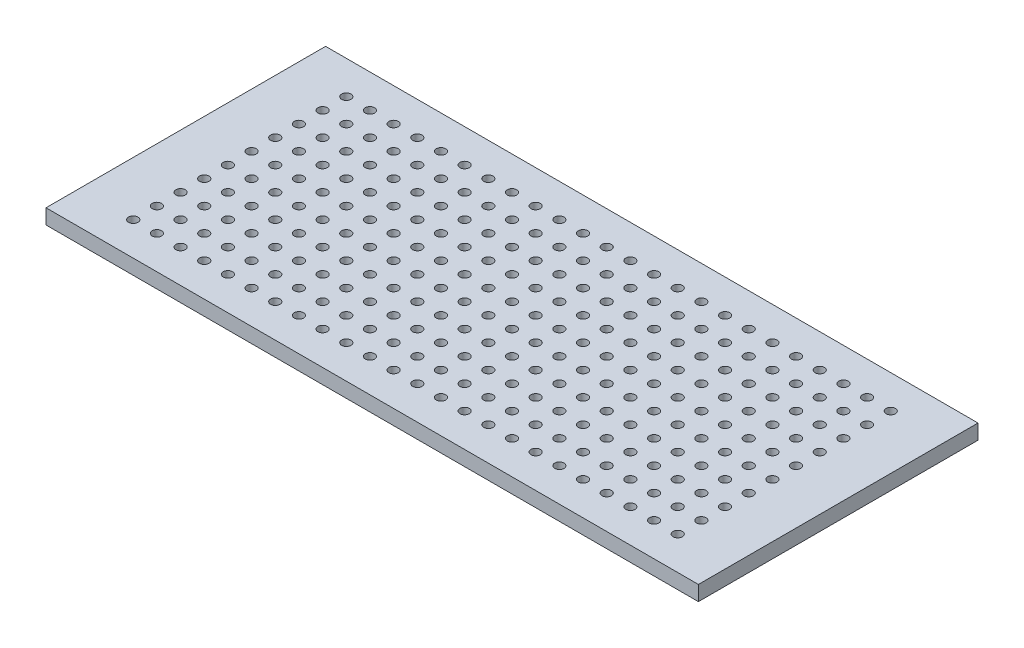
from build123d import *

# Parameters (mm, degrees)
SKETCH1_W                        = 70
SKETCH1_H                        = 30
BOSS_EXTRUDE1_DEPTH              = 1.6
F_1_0_1_DIAMETER_HOLE1_OUTLINE_R = 0.5
F_1_0_1_DIAMETER_HOLE1_DEPTH     = 1.6


# Read off the part's stored shape, not the designer's step: Ø1.0 (1) Diameter Hole1
with BuildPart() as part:
    # Sketch1 → Boss-Extrude1 (new body)
    with BuildSketch(Plane(origin=(0, 0, 0), x_dir=(1, 0, 0), z_dir=(0, 1, 0))):
        Rectangle(SKETCH1_W, SKETCH1_H)
    extrude(amount=BOSS_EXTRUDE1_DEPTH)

    # Ø1.0 (1) Diameter Hole1 outline → Ø1.0 (1) Diameter Hole1 (cut)
    with BuildSketch(Plane(origin=(0, 0, 0), x_dir=(1, 0, 0), z_dir=(0, 1, 0))):
        with Locations((1.27, 1.27)):
            Circle(F_1_0_1_DIAMETER_HOLE1_OUTLINE_R)
        with Locations((-1.27, 1.27)):
            Circle(F_1_0_1_DIAMETER_HOLE1_OUTLINE_R)
        with Locations((-3.81, 1.27)):
            Circle(F_1_0_1_DIAMETER_HOLE1_OUTLINE_R)
        with Locations((-6.35, 1.27)):
            Circle(F_1_0_1_DIAMETER_HOLE1_OUTLINE_R)
        with Locations((-16.51, -3.81)):
            Circle(F_1_0_1_DIAMETER_HOLE1_OUTLINE_R)
        with Locations((-6.35, 3.81)):
            Circle(F_1_0_1_DIAMETER_HOLE1_OUTLINE_R)
        with Locations((-3.81, 6.35)):
            Circle(F_1_0_1_DIAMETER_HOLE1_OUTLINE_R)
        with Locations((-3.81, 3.81)):
            Circle(F_1_0_1_DIAMETER_HOLE1_OUTLINE_R)
        with Locations((-1.27, 3.81)):
            Circle(F_1_0_1_DIAMETER_HOLE1_OUTLINE_R)
        with Locations((1.27, 3.81)):
            Circle(F_1_0_1_DIAMETER_HOLE1_OUTLINE_R)
        with Locations((1.27, 6.35)):
            Circle(F_1_0_1_DIAMETER_HOLE1_OUTLINE_R)
        with Locations((-1.27, 6.35)):
            Circle(F_1_0_1_DIAMETER_HOLE1_OUTLINE_R)
        with Locations((-6.35, 6.35)):
            Circle(F_1_0_1_DIAMETER_HOLE1_OUTLINE_R)
        with Locations((-6.35, 8.89)):
            Circle(F_1_0_1_DIAMETER_HOLE1_OUTLINE_R)
        with Locations((-3.81, 8.89)):
            Circle(F_1_0_1_DIAMETER_HOLE1_OUTLINE_R)
        with Locations((-1.27, 8.89)):
            Circle(F_1_0_1_DIAMETER_HOLE1_OUTLINE_R)
        with Locations((1.27, 8.89)):
            Circle(F_1_0_1_DIAMETER_HOLE1_OUTLINE_R)
        with Locations((1.27, 11.43)):
            Circle(F_1_0_1_DIAMETER_HOLE1_OUTLINE_R)
        with Locations((-1.27, 11.43)):
            Circle(F_1_0_1_DIAMETER_HOLE1_OUTLINE_R)
        with Locations((-3.81, 11.43)):
            Circle(F_1_0_1_DIAMETER_HOLE1_OUTLINE_R)
        with Locations((-6.35, 11.43)):
            Circle(F_1_0_1_DIAMETER_HOLE1_OUTLINE_R)
        with Locations((-8.89, 11.43)):
            Circle(F_1_0_1_DIAMETER_HOLE1_OUTLINE_R)
        with Locations((-8.89, 8.89)):
            Circle(F_1_0_1_DIAMETER_HOLE1_OUTLINE_R)
        with Locations((-8.89, 6.35)):
            Circle(F_1_0_1_DIAMETER_HOLE1_OUTLINE_R)
        with Locations((-8.89, 3.81)):
            Circle(F_1_0_1_DIAMETER_HOLE1_OUTLINE_R)
        with Locations((-8.89, 1.27)):
            Circle(F_1_0_1_DIAMETER_HOLE1_OUTLINE_R)
        with Locations((-11.43, 1.27)):
            Circle(F_1_0_1_DIAMETER_HOLE1_OUTLINE_R)
        with Locations((-11.43, 3.81)):
            Circle(F_1_0_1_DIAMETER_HOLE1_OUTLINE_R)
        with Locations((-11.43, 6.35)):
            Circle(F_1_0_1_DIAMETER_HOLE1_OUTLINE_R)
        with Locations((-11.43, 8.89)):
            Circle(F_1_0_1_DIAMETER_HOLE1_OUTLINE_R)
        with Locations((-11.43, 11.43)):
            Circle(F_1_0_1_DIAMETER_HOLE1_OUTLINE_R)
        with Locations((-13.97, 11.43)):
            Circle(F_1_0_1_DIAMETER_HOLE1_OUTLINE_R)
        with Locations((-13.97, 8.89)):
            Circle(F_1_0_1_DIAMETER_HOLE1_OUTLINE_R)
        with Locations((-13.97, 6.35)):
            Circle(F_1_0_1_DIAMETER_HOLE1_OUTLINE_R)
        with Locations((-13.97, 3.81)):
            Circle(F_1_0_1_DIAMETER_HOLE1_OUTLINE_R)
        with Locations((-13.97, 1.27)):
            Circle(F_1_0_1_DIAMETER_HOLE1_OUTLINE_R)
        with Locations((-16.51, 1.27)):
            Circle(F_1_0_1_DIAMETER_HOLE1_OUTLINE_R)
        with Locations((-19.05, 3.81)):
            Circle(F_1_0_1_DIAMETER_HOLE1_OUTLINE_R)
        with Locations((-16.51, 3.81)):
            Circle(F_1_0_1_DIAMETER_HOLE1_OUTLINE_R)
        with Locations((-16.51, 6.35)):
            Circle(F_1_0_1_DIAMETER_HOLE1_OUTLINE_R)
        with Locations((-16.51, 8.89)):
            Circle(F_1_0_1_DIAMETER_HOLE1_OUTLINE_R)
        with Locations((-19.05, 11.43)):
            Circle(F_1_0_1_DIAMETER_HOLE1_OUTLINE_R)
        with Locations((-16.51, 11.43)):
            Circle(F_1_0_1_DIAMETER_HOLE1_OUTLINE_R)
        with Locations((-19.05, 8.89)):
            Circle(F_1_0_1_DIAMETER_HOLE1_OUTLINE_R)
        with Locations((-19.05, 6.35)):
            Circle(F_1_0_1_DIAMETER_HOLE1_OUTLINE_R)
        with Locations((-19.05, 1.27)):
            Circle(F_1_0_1_DIAMETER_HOLE1_OUTLINE_R)
        with Locations((-19.05, -3.81)):
            Circle(F_1_0_1_DIAMETER_HOLE1_OUTLINE_R)
        with Locations((-19.05, -1.27)):
            Circle(F_1_0_1_DIAMETER_HOLE1_OUTLINE_R)
        with Locations((-16.51, -1.27)):
            Circle(F_1_0_1_DIAMETER_HOLE1_OUTLINE_R)
        with Locations((-13.97, -3.81)):
            Circle(F_1_0_1_DIAMETER_HOLE1_OUTLINE_R)
        with Locations((-13.97, -1.27)):
            Circle(F_1_0_1_DIAMETER_HOLE1_OUTLINE_R)
        with Locations((-11.43, -1.27)):
            Circle(F_1_0_1_DIAMETER_HOLE1_OUTLINE_R)
        with Locations((-11.43, -3.81)):
            Circle(F_1_0_1_DIAMETER_HOLE1_OUTLINE_R)
        with Locations((-8.89, -3.81)):
            Circle(F_1_0_1_DIAMETER_HOLE1_OUTLINE_R)
        with Locations((-8.89, -1.27)):
            Circle(F_1_0_1_DIAMETER_HOLE1_OUTLINE_R)
        with Locations((-6.35, -1.27)):
            Circle(F_1_0_1_DIAMETER_HOLE1_OUTLINE_R)
        with Locations((-6.35, -3.81)):
            Circle(F_1_0_1_DIAMETER_HOLE1_OUTLINE_R)
        with Locations((-3.81, -3.81)):
            Circle(F_1_0_1_DIAMETER_HOLE1_OUTLINE_R)
        with Locations((-3.81, -1.27)):
            Circle(F_1_0_1_DIAMETER_HOLE1_OUTLINE_R)
        with Locations((-1.27, -3.81)):
            Circle(F_1_0_1_DIAMETER_HOLE1_OUTLINE_R)
        with Locations((-1.27, -1.27)):
            Circle(F_1_0_1_DIAMETER_HOLE1_OUTLINE_R)
        with Locations((1.27, -1.27)):
            Circle(F_1_0_1_DIAMETER_HOLE1_OUTLINE_R)
        with Locations((1.27, -3.81)):
            Circle(F_1_0_1_DIAMETER_HOLE1_OUTLINE_R)
        with Locations((3.81, -3.81)):
            Circle(F_1_0_1_DIAMETER_HOLE1_OUTLINE_R)
        with Locations((6.35, -3.81)):
            Circle(F_1_0_1_DIAMETER_HOLE1_OUTLINE_R)
        with Locations((6.35, -1.27)):
            Circle(F_1_0_1_DIAMETER_HOLE1_OUTLINE_R)
        with Locations((3.81, -1.27)):
            Circle(F_1_0_1_DIAMETER_HOLE1_OUTLINE_R)
        with Locations((3.81, 1.27)):
            Circle(F_1_0_1_DIAMETER_HOLE1_OUTLINE_R)
        with Locations((6.35, 1.27)):
            Circle(F_1_0_1_DIAMETER_HOLE1_OUTLINE_R)
        with Locations((6.35, 3.81)):
            Circle(F_1_0_1_DIAMETER_HOLE1_OUTLINE_R)
        with Locations((3.81, 3.81)):
            Circle(F_1_0_1_DIAMETER_HOLE1_OUTLINE_R)
        with Locations((3.81, 6.35)):
            Circle(F_1_0_1_DIAMETER_HOLE1_OUTLINE_R)
        with Locations((6.35, 6.35)):
            Circle(F_1_0_1_DIAMETER_HOLE1_OUTLINE_R)
        with Locations((6.35, 8.89)):
            Circle(F_1_0_1_DIAMETER_HOLE1_OUTLINE_R)
        with Locations((3.81, 8.89)):
            Circle(F_1_0_1_DIAMETER_HOLE1_OUTLINE_R)
        with Locations((3.81, 11.43)):
            Circle(F_1_0_1_DIAMETER_HOLE1_OUTLINE_R)
        with Locations((6.35, 11.43)):
            Circle(F_1_0_1_DIAMETER_HOLE1_OUTLINE_R)
        with Locations((8.89, -1.27)):
            Circle(F_1_0_1_DIAMETER_HOLE1_OUTLINE_R)
        with Locations((8.89, -3.81)):
            Circle(F_1_0_1_DIAMETER_HOLE1_OUTLINE_R)
        with Locations((11.43, -3.81)):
            Circle(F_1_0_1_DIAMETER_HOLE1_OUTLINE_R)
        with Locations((11.43, -1.27)):
            Circle(F_1_0_1_DIAMETER_HOLE1_OUTLINE_R)
        with Locations((11.43, 1.27)):
            Circle(F_1_0_1_DIAMETER_HOLE1_OUTLINE_R)
        with Locations((8.89, 1.27)):
            Circle(F_1_0_1_DIAMETER_HOLE1_OUTLINE_R)
        with Locations((8.89, 3.81)):
            Circle(F_1_0_1_DIAMETER_HOLE1_OUTLINE_R)
        with Locations((11.43, 3.81)):
            Circle(F_1_0_1_DIAMETER_HOLE1_OUTLINE_R)
        with Locations((11.43, 6.35)):
            Circle(F_1_0_1_DIAMETER_HOLE1_OUTLINE_R)
        with Locations((8.89, 6.35)):
            Circle(F_1_0_1_DIAMETER_HOLE1_OUTLINE_R)
        with Locations((8.89, 8.89)):
            Circle(F_1_0_1_DIAMETER_HOLE1_OUTLINE_R)
        with Locations((8.89, 11.43)):
            Circle(F_1_0_1_DIAMETER_HOLE1_OUTLINE_R)
        with Locations((11.43, 8.89)):
            Circle(F_1_0_1_DIAMETER_HOLE1_OUTLINE_R)
        with Locations((11.43, 11.43)):
            Circle(F_1_0_1_DIAMETER_HOLE1_OUTLINE_R)
        with Locations((13.97, 11.43)):
            Circle(F_1_0_1_DIAMETER_HOLE1_OUTLINE_R)
        with Locations((16.51, -1.27)):
            Circle(F_1_0_1_DIAMETER_HOLE1_OUTLINE_R)
        with Locations((16.51, 1.27)):
            Circle(F_1_0_1_DIAMETER_HOLE1_OUTLINE_R)
        with Locations((16.51, 3.81)):
            Circle(F_1_0_1_DIAMETER_HOLE1_OUTLINE_R)
        with Locations((16.51, 6.35)):
            Circle(F_1_0_1_DIAMETER_HOLE1_OUTLINE_R)
        with Locations((16.51, 8.89)):
            Circle(F_1_0_1_DIAMETER_HOLE1_OUTLINE_R)
        with Locations((16.51, 11.43)):
            Circle(F_1_0_1_DIAMETER_HOLE1_OUTLINE_R)
        with Locations((13.97, 8.89)):
            Circle(F_1_0_1_DIAMETER_HOLE1_OUTLINE_R)
        with Locations((13.97, 6.35)):
            Circle(F_1_0_1_DIAMETER_HOLE1_OUTLINE_R)
        with Locations((13.97, 3.81)):
            Circle(F_1_0_1_DIAMETER_HOLE1_OUTLINE_R)
        with Locations((13.97, 1.27)):
            Circle(F_1_0_1_DIAMETER_HOLE1_OUTLINE_R)
        with Locations((13.97, -1.27)):
            Circle(F_1_0_1_DIAMETER_HOLE1_OUTLINE_R)
        with Locations((13.97, -3.81)):
            Circle(F_1_0_1_DIAMETER_HOLE1_OUTLINE_R)
        with Locations((16.51, -3.81)):
            Circle(F_1_0_1_DIAMETER_HOLE1_OUTLINE_R)
        with Locations((19.05, -3.81)):
            Circle(F_1_0_1_DIAMETER_HOLE1_OUTLINE_R)
        with Locations((21.59, -3.81)):
            Circle(F_1_0_1_DIAMETER_HOLE1_OUTLINE_R)
        with Locations((21.59, -1.27)):
            Circle(F_1_0_1_DIAMETER_HOLE1_OUTLINE_R)
        with Locations((19.05, -1.27)):
            Circle(F_1_0_1_DIAMETER_HOLE1_OUTLINE_R)
        with Locations((19.05, 1.27)):
            Circle(F_1_0_1_DIAMETER_HOLE1_OUTLINE_R)
        with Locations((19.05, 3.81)):
            Circle(F_1_0_1_DIAMETER_HOLE1_OUTLINE_R)
        with Locations((19.05, 6.35)):
            Circle(F_1_0_1_DIAMETER_HOLE1_OUTLINE_R)
        with Locations((19.05, 8.89)):
            Circle(F_1_0_1_DIAMETER_HOLE1_OUTLINE_R)
        with Locations((19.05, 11.43)):
            Circle(F_1_0_1_DIAMETER_HOLE1_OUTLINE_R)
        with Locations((21.59, 11.43)):
            Circle(F_1_0_1_DIAMETER_HOLE1_OUTLINE_R)
        with Locations((21.59, 8.89)):
            Circle(F_1_0_1_DIAMETER_HOLE1_OUTLINE_R)
        with Locations((21.59, 6.35)):
            Circle(F_1_0_1_DIAMETER_HOLE1_OUTLINE_R)
        with Locations((21.59, 3.81)):
            Circle(F_1_0_1_DIAMETER_HOLE1_OUTLINE_R)
        with Locations((21.59, 1.27)):
            Circle(F_1_0_1_DIAMETER_HOLE1_OUTLINE_R)
        with Locations((26.67, 1.27)):
            Circle(F_1_0_1_DIAMETER_HOLE1_OUTLINE_R)
        with Locations((26.67, 3.81)):
            Circle(F_1_0_1_DIAMETER_HOLE1_OUTLINE_R)
        with Locations((26.67, 6.35)):
            Circle(F_1_0_1_DIAMETER_HOLE1_OUTLINE_R)
        with Locations((26.67, 8.89)):
            Circle(F_1_0_1_DIAMETER_HOLE1_OUTLINE_R)
        with Locations((26.67, 11.43)):
            Circle(F_1_0_1_DIAMETER_HOLE1_OUTLINE_R)
        with Locations((24.13, 11.43)):
            Circle(F_1_0_1_DIAMETER_HOLE1_OUTLINE_R)
        with Locations((24.13, 8.89)):
            Circle(F_1_0_1_DIAMETER_HOLE1_OUTLINE_R)
        with Locations((24.13, 6.35)):
            Circle(F_1_0_1_DIAMETER_HOLE1_OUTLINE_R)
        with Locations((24.13, 3.81)):
            Circle(F_1_0_1_DIAMETER_HOLE1_OUTLINE_R)
        with Locations((24.13, 1.27)):
            Circle(F_1_0_1_DIAMETER_HOLE1_OUTLINE_R)
        with Locations((24.13, -3.81)):
            Circle(F_1_0_1_DIAMETER_HOLE1_OUTLINE_R)
        with Locations((24.13, -1.27)):
            Circle(F_1_0_1_DIAMETER_HOLE1_OUTLINE_R)
        with Locations((26.67, -1.27)):
            Circle(F_1_0_1_DIAMETER_HOLE1_OUTLINE_R)
        with Locations((26.67, -3.81)):
            Circle(F_1_0_1_DIAMETER_HOLE1_OUTLINE_R)
        with Locations((26.67, -8.89)):
            Circle(F_1_0_1_DIAMETER_HOLE1_OUTLINE_R)
        with Locations((24.13, -8.89)):
            Circle(F_1_0_1_DIAMETER_HOLE1_OUTLINE_R)
        with Locations((21.59, -8.89)):
            Circle(F_1_0_1_DIAMETER_HOLE1_OUTLINE_R)
        with Locations((19.05, -8.89)):
            Circle(F_1_0_1_DIAMETER_HOLE1_OUTLINE_R)
        with Locations((16.51, -8.89)):
            Circle(F_1_0_1_DIAMETER_HOLE1_OUTLINE_R)
        with Locations((13.97, -8.89)):
            Circle(F_1_0_1_DIAMETER_HOLE1_OUTLINE_R)
        with Locations((11.43, -8.89)):
            Circle(F_1_0_1_DIAMETER_HOLE1_OUTLINE_R)
        with Locations((8.89, -8.89)):
            Circle(F_1_0_1_DIAMETER_HOLE1_OUTLINE_R)
        with Locations((6.35, -8.89)):
            Circle(F_1_0_1_DIAMETER_HOLE1_OUTLINE_R)
        with Locations((3.81, -8.89)):
            Circle(F_1_0_1_DIAMETER_HOLE1_OUTLINE_R)
        with Locations((1.27, -8.89)):
            Circle(F_1_0_1_DIAMETER_HOLE1_OUTLINE_R)
        with Locations((-1.27, -8.89)):
            Circle(F_1_0_1_DIAMETER_HOLE1_OUTLINE_R)
        with Locations((-3.81, -8.89)):
            Circle(F_1_0_1_DIAMETER_HOLE1_OUTLINE_R)
        with Locations((-6.35, -8.89)):
            Circle(F_1_0_1_DIAMETER_HOLE1_OUTLINE_R)
        with Locations((-8.89, -8.89)):
            Circle(F_1_0_1_DIAMETER_HOLE1_OUTLINE_R)
        with Locations((-11.43, -8.89)):
            Circle(F_1_0_1_DIAMETER_HOLE1_OUTLINE_R)
        with Locations((-16.51, -11.43)):
            Circle(F_1_0_1_DIAMETER_HOLE1_OUTLINE_R)
        with Locations((-19.05, -11.43)):
            Circle(F_1_0_1_DIAMETER_HOLE1_OUTLINE_R)
        with Locations((-19.05, -8.89)):
            Circle(F_1_0_1_DIAMETER_HOLE1_OUTLINE_R)
        with Locations((-16.51, -8.89)):
            Circle(F_1_0_1_DIAMETER_HOLE1_OUTLINE_R)
        with Locations((-13.97, -8.89)):
            Circle(F_1_0_1_DIAMETER_HOLE1_OUTLINE_R)
        with Locations((-13.97, -11.43)):
            Circle(F_1_0_1_DIAMETER_HOLE1_OUTLINE_R)
        with Locations((-11.43, -11.43)):
            Circle(F_1_0_1_DIAMETER_HOLE1_OUTLINE_R)
        with Locations((-8.89, -11.43)):
            Circle(F_1_0_1_DIAMETER_HOLE1_OUTLINE_R)
        with Locations((-6.35, -11.43)):
            Circle(F_1_0_1_DIAMETER_HOLE1_OUTLINE_R)
        with Locations((-3.81, -11.43)):
            Circle(F_1_0_1_DIAMETER_HOLE1_OUTLINE_R)
        with Locations((-1.27, -11.43)):
            Circle(F_1_0_1_DIAMETER_HOLE1_OUTLINE_R)
        with Locations((1.27, -11.43)):
            Circle(F_1_0_1_DIAMETER_HOLE1_OUTLINE_R)
        with Locations((3.81, -11.43)):
            Circle(F_1_0_1_DIAMETER_HOLE1_OUTLINE_R)
        with Locations((6.35, -11.43)):
            Circle(F_1_0_1_DIAMETER_HOLE1_OUTLINE_R)
        with Locations((8.89, -11.43)):
            Circle(F_1_0_1_DIAMETER_HOLE1_OUTLINE_R)
        with Locations((11.43, -11.43)):
            Circle(F_1_0_1_DIAMETER_HOLE1_OUTLINE_R)
        with Locations((13.97, -11.43)):
            Circle(F_1_0_1_DIAMETER_HOLE1_OUTLINE_R)
        with Locations((16.51, -11.43)):
            Circle(F_1_0_1_DIAMETER_HOLE1_OUTLINE_R)
        with Locations((19.05, -11.43)):
            Circle(F_1_0_1_DIAMETER_HOLE1_OUTLINE_R)
        with Locations((21.59, -11.43)):
            Circle(F_1_0_1_DIAMETER_HOLE1_OUTLINE_R)
        with Locations((24.13, -11.43)):
            Circle(F_1_0_1_DIAMETER_HOLE1_OUTLINE_R)
        with Locations((26.67, -11.43)):
            Circle(F_1_0_1_DIAMETER_HOLE1_OUTLINE_R)
        with Locations((29.21, -11.43)):
            Circle(F_1_0_1_DIAMETER_HOLE1_OUTLINE_R)
        with Locations((29.21, -8.89)):
            Circle(F_1_0_1_DIAMETER_HOLE1_OUTLINE_R)
        with Locations((29.21, 11.43)):
            Circle(F_1_0_1_DIAMETER_HOLE1_OUTLINE_R)
        with Locations((29.21, 8.89)):
            Circle(F_1_0_1_DIAMETER_HOLE1_OUTLINE_R)
        with Locations((29.21, 6.35)):
            Circle(F_1_0_1_DIAMETER_HOLE1_OUTLINE_R)
        with Locations((29.21, 3.81)):
            Circle(F_1_0_1_DIAMETER_HOLE1_OUTLINE_R)
        with Locations((29.21, 1.27)):
            Circle(F_1_0_1_DIAMETER_HOLE1_OUTLINE_R)
        with Locations((29.21, -1.27)):
            Circle(F_1_0_1_DIAMETER_HOLE1_OUTLINE_R)
        with Locations((29.21, -3.81)):
            Circle(F_1_0_1_DIAMETER_HOLE1_OUTLINE_R)
        with Locations((29.21, -6.35)):
            Circle(F_1_0_1_DIAMETER_HOLE1_OUTLINE_R)
        with Locations((26.67, -6.35)):
            Circle(F_1_0_1_DIAMETER_HOLE1_OUTLINE_R)
        with Locations((24.13, -6.35)):
            Circle(F_1_0_1_DIAMETER_HOLE1_OUTLINE_R)
        with Locations((21.59, -6.35)):
            Circle(F_1_0_1_DIAMETER_HOLE1_OUTLINE_R)
        with Locations((19.05, -6.35)):
            Circle(F_1_0_1_DIAMETER_HOLE1_OUTLINE_R)
        with Locations((16.51, -6.35)):
            Circle(F_1_0_1_DIAMETER_HOLE1_OUTLINE_R)
        with Locations((13.97, -6.35)):
            Circle(F_1_0_1_DIAMETER_HOLE1_OUTLINE_R)
        with Locations((11.43, -6.35)):
            Circle(F_1_0_1_DIAMETER_HOLE1_OUTLINE_R)
        with Locations((8.89, -6.35)):
            Circle(F_1_0_1_DIAMETER_HOLE1_OUTLINE_R)
        with Locations((6.35, -6.35)):
            Circle(F_1_0_1_DIAMETER_HOLE1_OUTLINE_R)
        with Locations((3.81, -6.35)):
            Circle(F_1_0_1_DIAMETER_HOLE1_OUTLINE_R)
        with Locations((1.27, -6.35)):
            Circle(F_1_0_1_DIAMETER_HOLE1_OUTLINE_R)
        with Locations((-1.27, -6.35)):
            Circle(F_1_0_1_DIAMETER_HOLE1_OUTLINE_R)
        with Locations((-3.81, -6.35)):
            Circle(F_1_0_1_DIAMETER_HOLE1_OUTLINE_R)
        with Locations((-6.35, -6.35)):
            Circle(F_1_0_1_DIAMETER_HOLE1_OUTLINE_R)
        with Locations((-8.89, -6.35)):
            Circle(F_1_0_1_DIAMETER_HOLE1_OUTLINE_R)
        with Locations((-11.43, -6.35)):
            Circle(F_1_0_1_DIAMETER_HOLE1_OUTLINE_R)
        with Locations((-13.97, -6.35)):
            Circle(F_1_0_1_DIAMETER_HOLE1_OUTLINE_R)
        with Locations((-16.51, -6.35)):
            Circle(F_1_0_1_DIAMETER_HOLE1_OUTLINE_R)
        with Locations((-19.05, -6.35)):
            Circle(F_1_0_1_DIAMETER_HOLE1_OUTLINE_R)
        with Locations((-21.59, -6.35)):
            Circle(F_1_0_1_DIAMETER_HOLE1_OUTLINE_R)
        with Locations((-21.59, -3.81)):
            Circle(F_1_0_1_DIAMETER_HOLE1_OUTLINE_R)
        with Locations((-21.59, -1.27)):
            Circle(F_1_0_1_DIAMETER_HOLE1_OUTLINE_R)
        with Locations((-21.59, 1.27)):
            Circle(F_1_0_1_DIAMETER_HOLE1_OUTLINE_R)
        with Locations((-21.59, 3.81)):
            Circle(F_1_0_1_DIAMETER_HOLE1_OUTLINE_R)
        with Locations((-21.59, 6.35)):
            Circle(F_1_0_1_DIAMETER_HOLE1_OUTLINE_R)
        with Locations((-21.59, 8.89)):
            Circle(F_1_0_1_DIAMETER_HOLE1_OUTLINE_R)
        with Locations((-21.59, 11.43)):
            Circle(F_1_0_1_DIAMETER_HOLE1_OUTLINE_R)
        with Locations((-24.13, 11.43)):
            Circle(F_1_0_1_DIAMETER_HOLE1_OUTLINE_R)
        with Locations((-24.13, 8.89)):
            Circle(F_1_0_1_DIAMETER_HOLE1_OUTLINE_R)
        with Locations((-24.13, 6.35)):
            Circle(F_1_0_1_DIAMETER_HOLE1_OUTLINE_R)
        with Locations((-24.13, 3.81)):
            Circle(F_1_0_1_DIAMETER_HOLE1_OUTLINE_R)
        with Locations((-24.13, 1.27)):
            Circle(F_1_0_1_DIAMETER_HOLE1_OUTLINE_R)
        with Locations((-24.13, -1.27)):
            Circle(F_1_0_1_DIAMETER_HOLE1_OUTLINE_R)
        with Locations((-24.13, -3.81)):
            Circle(F_1_0_1_DIAMETER_HOLE1_OUTLINE_R)
        with Locations((-24.13, -6.35)):
            Circle(F_1_0_1_DIAMETER_HOLE1_OUTLINE_R)
        with Locations((-24.13, -8.89)):
            Circle(F_1_0_1_DIAMETER_HOLE1_OUTLINE_R)
        with Locations((-21.59, -8.89)):
            Circle(F_1_0_1_DIAMETER_HOLE1_OUTLINE_R)
        with Locations((-21.59, -11.43)):
            Circle(F_1_0_1_DIAMETER_HOLE1_OUTLINE_R)
        with Locations((-24.13, -11.43)):
            Circle(F_1_0_1_DIAMETER_HOLE1_OUTLINE_R)
        with Locations((-29.21, -11.43)):
            Circle(F_1_0_1_DIAMETER_HOLE1_OUTLINE_R)
        with Locations((-26.67, -11.43)):
            Circle(F_1_0_1_DIAMETER_HOLE1_OUTLINE_R)
        with Locations((-26.67, -8.89)):
            Circle(F_1_0_1_DIAMETER_HOLE1_OUTLINE_R)
        with Locations((-29.21, -8.89)):
            Circle(F_1_0_1_DIAMETER_HOLE1_OUTLINE_R)
        with Locations((-29.21, -6.35)):
            Circle(F_1_0_1_DIAMETER_HOLE1_OUTLINE_R)
        with Locations((-26.67, -6.35)):
            Circle(F_1_0_1_DIAMETER_HOLE1_OUTLINE_R)
        with Locations((-26.67, -3.81)):
            Circle(F_1_0_1_DIAMETER_HOLE1_OUTLINE_R)
        with Locations((-29.21, -3.81)):
            Circle(F_1_0_1_DIAMETER_HOLE1_OUTLINE_R)
        with Locations((-29.21, -1.27)):
            Circle(F_1_0_1_DIAMETER_HOLE1_OUTLINE_R)
        with Locations((-26.67, -1.27)):
            Circle(F_1_0_1_DIAMETER_HOLE1_OUTLINE_R)
        with Locations((-26.67, 1.27)):
            Circle(F_1_0_1_DIAMETER_HOLE1_OUTLINE_R)
        with Locations((-29.21, 1.27)):
            Circle(F_1_0_1_DIAMETER_HOLE1_OUTLINE_R)
        with Locations((-29.21, 3.81)):
            Circle(F_1_0_1_DIAMETER_HOLE1_OUTLINE_R)
        with Locations((-26.67, 3.81)):
            Circle(F_1_0_1_DIAMETER_HOLE1_OUTLINE_R)
        with Locations((-26.67, 6.35)):
            Circle(F_1_0_1_DIAMETER_HOLE1_OUTLINE_R)
        with Locations((-29.21, 6.35)):
            Circle(F_1_0_1_DIAMETER_HOLE1_OUTLINE_R)
        with Locations((-29.21, 8.89)):
            Circle(F_1_0_1_DIAMETER_HOLE1_OUTLINE_R)
        with Locations((-26.67, 8.89)):
            Circle(F_1_0_1_DIAMETER_HOLE1_OUTLINE_R)
        with Locations((-26.67, 11.43)):
            Circle(F_1_0_1_DIAMETER_HOLE1_OUTLINE_R)
        with Locations((-29.21, 11.43)):
            Circle(F_1_0_1_DIAMETER_HOLE1_OUTLINE_R)
    extrude(amount=F_1_0_1_DIAMETER_HOLE1_DEPTH, mode=Mode.SUBTRACT)


solid = part.part
